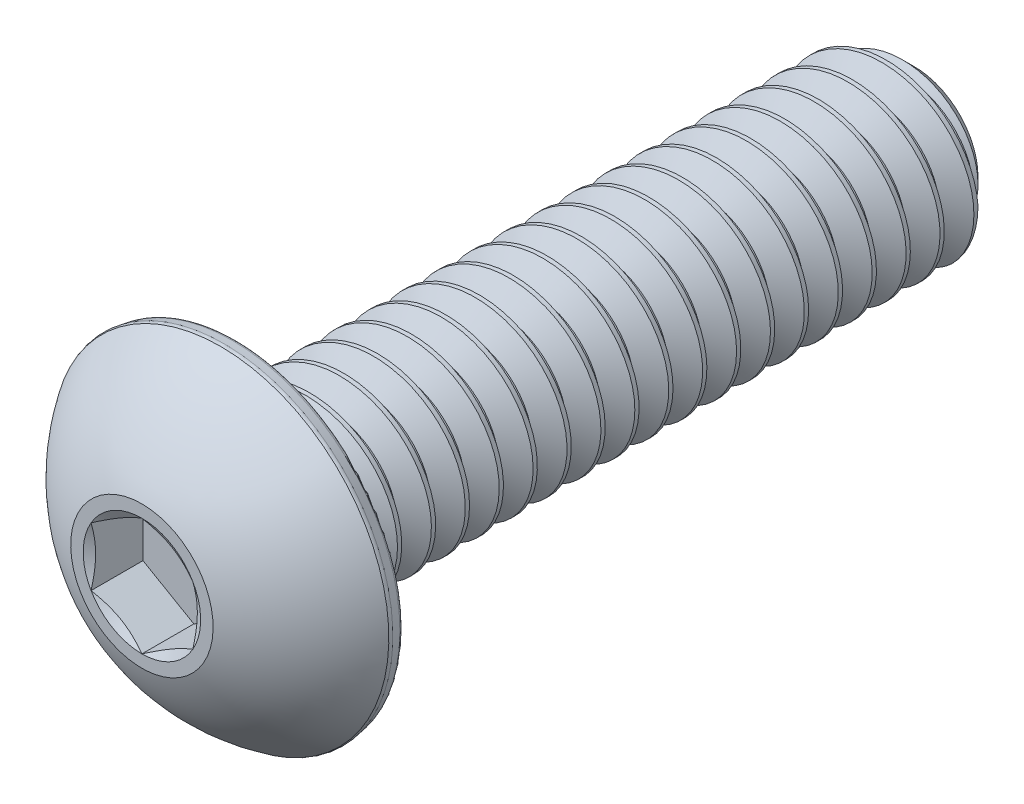
from build123d import *

# Parameters (mm, degrees)
CUT_EXTRUDE1_DEPTH = 1.21539
FILLET1_R          = 0.11049
CUT_SWEEP1_PITCH   = 0.79375
CUT_SWEEP1_TO      = 15.875


with BuildPart() as part:
    # Sketch3 → Revolve1 (revolve)
    with BuildSketch(Plane(origin=(0, 0, 0), x_dir=(0, 0, -1), z_dir=(1, 0, 0)), mode=Mode.PRIVATE) as revolve1_sk:
        with BuildLine():
            Line((-9.0424, 0), (-9.0424, 1.666875))
            ThreePointArc((-9.0424, 1.666875), (-8.289670588, 2.967189774), (-7.16407, 3.9624))
            Line((-7.16407, 3.9624), (-6.8326, 3.903952896))
            Line((-6.8326, 3.903952896), (-6.8326, 2.0828))
            Line((-6.8326, 2.0828), (8.4470875, 2.0828))
            Line((8.4470875, 2.0828), (9.0424, 1.4874875))
            Line((9.0424, 1.4874875), (9.0424, 0))
            Line((9.0424, 0), (-9.0424, 0))
        make_face()
    revolve(revolve1_sk.sketch.rotate(Axis((0, 0, 9.0424), (0, 0, -1)), 90), axis=Axis((0, 0, 9.0424), (0, 0, -1)))

    # Sketch4 → Cut-Extrude1 (cut)
    with BuildSketch(Plane.XY.offset(9.0424)):
        Polygon((-1.190625, -0.687407664), (0, -1.374815329), (1.190625, -0.687407664), (1.190625, 0.687407664), (0, 1.374815329), (-1.190625, 0.687407664), align=None)
    extrude(amount=-CUT_EXTRUDE1_DEPTH, mode=Mode.SUBTRACT)

    # Cut-Extrude2 cone 1 section (through the dimple's axis) → Cut-Extrude2 (revolve, cut)
    with BuildSketch(Plane(origin=(0, 0, 9.0424), x_dir=(0, -1, 0), z_dir=(1, 0, 0))):
        Polygon((0, 0), (1.374815329, 0), (0, 0.79375), align=None)
    revolve(axis=Axis((0, 0, 9.0424), (0, 0, -1)), mode=Mode.SUBTRACT)

    # Fillet1
    fillet1_edges = [part.edges().sort_by_distance(p)[0] for p in [
        (-3.903952896, 0, 6.8326),
        (-3.9624, 0, 7.16407),
    ]]
    fillet(fillet1_edges, radius=FILLET1_R)


with BuildPart() as body_2:
    # Split1: read off the stored shape, not the designer's step
    # Split1: the piece on the far side of the plane
    add(part.part)
    split(bisect_by=Plane.XY.offset(6.8326), keep=Keep.BOTTOM)

    # Cut-Sweep1: arcs per turn and ends read off the stored shape
    # Cut-Sweep1: the profile of Sketch7 screwed along a right-hand helix through 21 turns, 8 arcs to a turn; built about Z, then put on its axis
    cut_sweep1_z = Axis((0, 0, 0), (0, 0, 1))
    cut_sweep1_corners = [(2.125762979, 0, 0.024804687), (2.125762979, 0, -0.719335938), (1.567244252, 0, -0.396875), (1.567244252, 0, -0.29765625)]
    with BuildLine(mode=Mode.PRIVATE) as cut_sweep1_profile:
        Line(cut_sweep1_corners[0], cut_sweep1_corners[1])
        Line(cut_sweep1_corners[1], cut_sweep1_corners[2])
        Line(cut_sweep1_corners[2], cut_sweep1_corners[3])
        Line(cut_sweep1_corners[3], cut_sweep1_corners[0])
    cut_sweep1_cap = Face(cut_sweep1_profile.wire())
    cut_sweep1_turn_angles = [0, 22.5, 45, 67.5, 90, 112.5, 135, 157.5, 180, 202.5, 225, 247.5, 270, 292.5, 315, 337.5, 360]
    cut_sweep1_turn_weights = [1, 0.9238795325112867, 1, 0.9238795325112867, 1, 0.9238795325112867, 1, 0.9238795325112867, 1, 0.9238795325112867, 1, 0.9238795325112867, 1, 0.9238795325112867, 1, 0.9238795325112867, 1]
    cut_sweep1_turn_rails = [Edge.make_bspline([Vector(p[0], p[1], 0).rotate(cut_sweep1_z, cut_sweep1_turn_angles[k]) / cut_sweep1_turn_weights[k] + Vector(0, 0, p[2] + CUT_SWEEP1_PITCH * cut_sweep1_turn_angles[k] / 360) for k in range(17)], [0, 0, 0, 1, 1, 2, 2, 3, 3, 4, 4, 5, 5, 6, 6, 7, 7, 8, 8, 8], 2, cut_sweep1_turn_weights) for p in cut_sweep1_corners]
    cut_sweep1_turn_sides = [Face.make_surface_from_curves(cut_sweep1_turn_rails[p[0]], cut_sweep1_turn_rails[p[1]]) for p in [(0, 1), (1, 2), (2, 3), (3, 0)]]
    cut_sweep1 = Plane(origin=(0, 0, -9.0424), x_dir=(0, 1, 0), z_dir=(0, 0, 1)) * split(Solid(Shell([*[p.moved(Location((0, 0, CUT_SWEEP1_PITCH * i))) for i in range(21) for p in cut_sweep1_turn_sides], cut_sweep1_cap, cut_sweep1_cap.rotate(cut_sweep1_z, 7560).moved(Location((0, 0, CUT_SWEEP1_PITCH * 7560 / 360)))])), bisect_by=Plane.XY.offset(CUT_SWEEP1_TO), keep=Keep.BOTTOM, mode=Mode.PRIVATE)
    add(cut_sweep1, mode=Mode.SUBTRACT)


with BuildPart() as part_1:
    add(part.part)

    # Split1
    split(bisect_by=Plane.XY.offset(6.8326), keep=Keep.TOP)

    add(body_2.part)  # Boss-Extrude1 merges body 2
    # Boss-Extrude1 cone 1 section (through the dimple's axis) → Boss-Extrude1 (revolve)
    with BuildSketch(Plane(origin=(0, 0, 6.8326), x_dir=(0, -1, 0), z_dir=(1, 0, 0))):
        Polygon((0, 0), (2.168725958, 0), (0, 2.168725958), align=None)
    revolve(axis=Axis((0, 0, 6.8326), (0, 0, -1)))


solid = part_1.part
